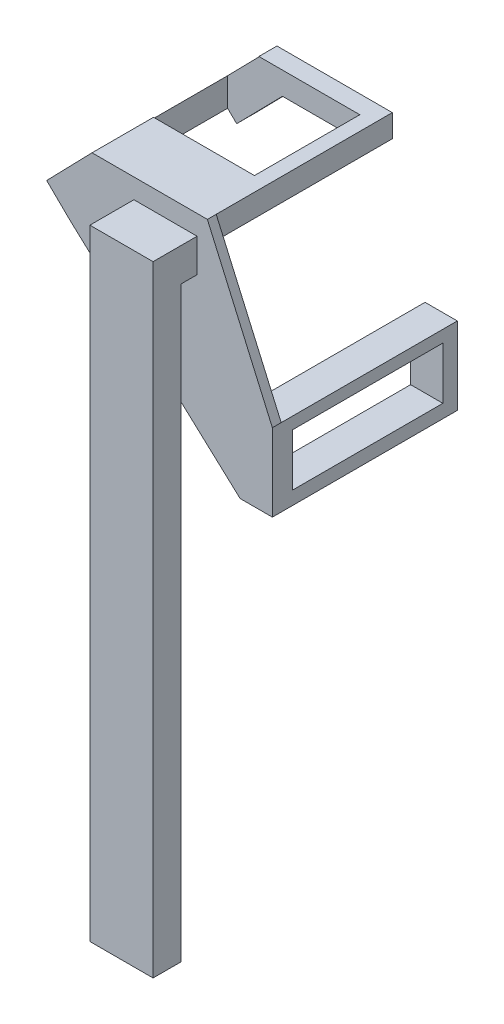
from build123d import *

# Parameters (mm, degrees)
BOSS_EXTRUDE1_DEPTH   = 60
SKETCH1_W             = 10.993820537
SKETCH1_H             = 26.396502677
BOSS_EXTRUDE1_2_DEPTH = 60
BOSS_EXTRUDE2_DEPTH   = 3
SKETCH3_W             = 21.528788888
SKETCH3_H             = 11.346253603
BOSS_EXTRUDE3_DEPTH   = 15
SKETCH4_W             = 21.528788888
SKETCH4_H             = 9.567300702
BOSS_EXTRUDE4_DEPTH   = 200
SKETCH5_W             = 51.310621716
SKETCH5_H             = 17.784956531
CUT_EXTRUDE1_DEPTH    = 200
SKETCH6_W             = 45.030110597
SKETCH6_H             = 35.891646976
CUT_EXTRUDE2_DEPTH    = 200


with BuildPart() as part:
    # Sketch1 → Boss-Extrude1 (new body)
    with BuildSketch(Plane.XY):
        Polygon((11.507697245, 26.038756838), (-27.787096512, 26.038756838), (-27.787096512, 25.885892475), (-43.235049783, 10.14086318), (-35.355311996, 2.409799691), (-19.757378597, 18.307693349), (11.507697245, 18.307693349), align=None)
    extrude(amount=BOSS_EXTRUDE1_DEPTH)



with BuildPart() as body_2:
    # Sketch1 → Boss-Extrude1 2 (new body)
    with BuildSketch(Plane.XY):
        with Locations((28.155491547, -37.552817793)):
            Rectangle(SKETCH1_W, SKETCH1_H)
    extrude(amount=BOSS_EXTRUDE1_2_DEPTH)


with BuildPart() as part_1:
    add(part.part)

    add(body_2.part)  # Boss-Extrude2 merges body 2
    # Sketch2 → Boss-Extrude2 (add)
    with BuildSketch(Plane.XY.offset(60)):
        Polygon((-43.235049783, 10.14086318), (-27.787096512, 26.038756838), (11.507697245, 26.038756838), (33.652401815, -24.354566454), (33.652401815, -50.751069131), (22.658581278, -50.751069131), (-35.355311996, 2.409799691), align=None)
    extrude(amount=BOSS_EXTRUDE2_DEPTH)

    # Sketch3 → Boss-Extrude3 (add)
    with BuildSketch(Plane.XY.offset(63)):
        with Locations((-2.754816927, 13.64397724)):
            Rectangle(SKETCH3_W, SKETCH3_H)
    extrude(amount=BOSS_EXTRUDE3_DEPTH)

    # Sketch4 → Boss-Extrude4 (add)
    with BuildSketch(Plane.XZ.offset(-7.970850439)):
        with Locations((-2.754816927, 73.216349649)):
            Rectangle(SKETCH4_W, SKETCH4_H)
    extrude(amount=BOSS_EXTRUDE4_DEPTH)

    # Sketch5 → Cut-Extrude1 (cut)
    with BuildSketch(Plane.ZY.offset(-22.658581278)):
        with Locations((30.574482512, -37.306256307)):
            Rectangle(SKETCH5_W, SKETCH5_H)
    extrude(amount=-CUT_EXTRUDE1_DEPTH, mode=Mode.SUBTRACT)

    # Sketch6 → Cut-Extrude2 (cut)
    with BuildSketch(Plane(origin=(0, 26.038756838, 0), x_dir=(1, 0, 0), z_dir=(0, 1, 0))):
        with Locations((-15.916410132, -24.110147888)):
            Rectangle(SKETCH6_W, SKETCH6_H)
    extrude(amount=-CUT_EXTRUDE2_DEPTH, mode=Mode.SUBTRACT)


solid = part_1.part
